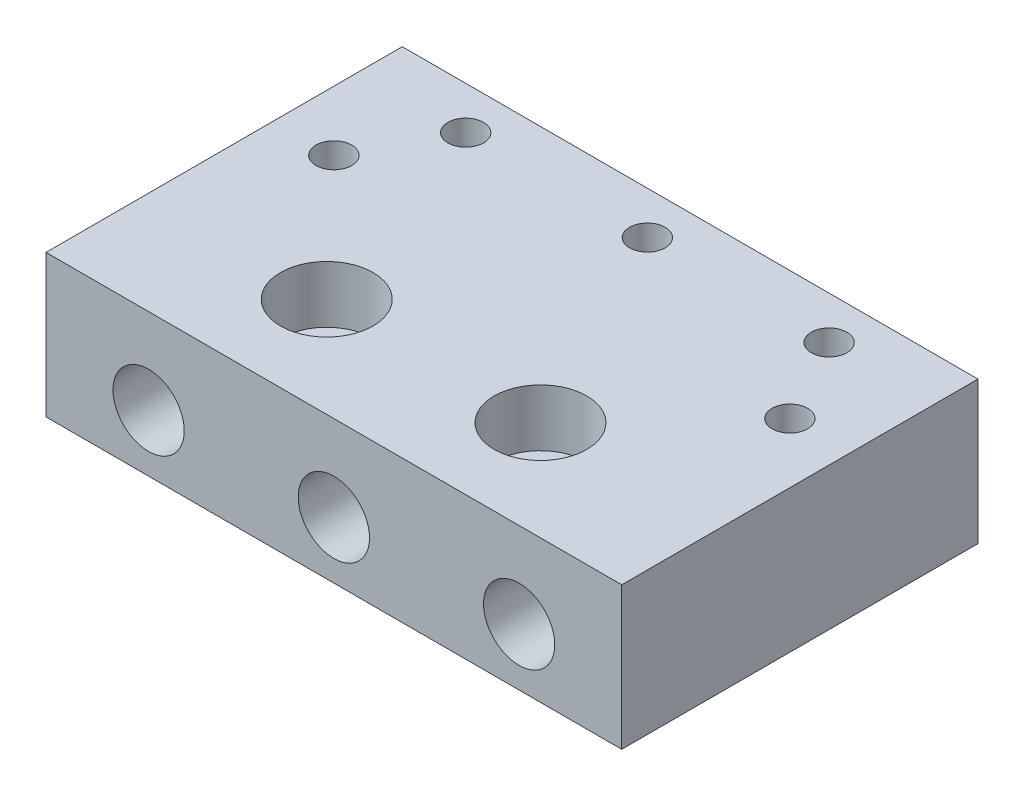
from build123d import *
from OCP.BRepFilletAPI import BRepFilletAPI_MakeChamfer

# Parameters (mm, degrees)
SKETCH1_W           = 40.4
SKETCH1_H           = 10
SKETCH1_R           = 2.5
BOSS_EXTRUDE1_DEPTH = 25
SKETCH2_R           = 1.55
CUT_EXTRUDE1_DEPTH  = 34.66065953
CUT_EXTRUDE2_REACH  = 35.661
SKETCH3_R           = 1.25
SKETCH4_R           = 1.25
CUT_EXTRUDE3_DEPTH  = 4
CHAMFER1_SIZE       = 0.891616335
CHAMFER1_SIZE_2     = 1.25
SKETCH5_R           = 3.25
CUT_EXTRUDE4_DEPTH  = 4


with BuildPart() as part:
    # Sketch1 → Boss-Extrude1 (new body)
    with BuildSketch(Plane.XY):
        with Locations((0, 1)):
            Rectangle(SKETCH1_W, SKETCH1_H)
        Circle(SKETCH1_R, mode=Mode.SUBTRACT)
        with Locations((13, 0)):
            Circle(SKETCH1_R, mode=Mode.SUBTRACT)
        with Locations((-13, 0)):
            Circle(SKETCH1_R, mode=Mode.SUBTRACT)
    extrude(amount=BOSS_EXTRUDE1_DEPTH)

    # Sketch2 → Cut-Extrude1 (cut, through all)
    with BuildSketch(Plane(origin=(0, 6, 0), x_dir=(1, 0, 0), z_dir=(0, 1, 0))):
        with Locations(Location((7.5, -18, 0), (0, 0, 180))):
            Circle(SKETCH2_R)
        with Locations(Location((-7.5, -18, 0), (0, 0, 180))):
            Circle(SKETCH2_R)
    extrude(amount=-CUT_EXTRUDE1_DEPTH, mode=Mode.SUBTRACT)

    # Sketch3 → Cut-Extrude2 (cut, up to next)
    with BuildSketch(Plane(origin=(0, 6, 0), x_dir=(1, 0, 0), z_dir=(0, 1, 0)), mode=Mode.PRIVATE) as cut_extrude2_sk1:
        with Locations(Location((0, -3, 0), (0, 0, 180))):
            Circle(SKETCH3_R)
    cut_extrude2_tool1 = extrude(cut_extrude2_sk1.sketch, amount=-CUT_EXTRUDE2_REACH, mode=Mode.PRIVATE) & part.part
    # Sketch3 → Cut-Extrude2 (cut, up to next)
    with BuildSketch(Plane(origin=(0, 6, 0), x_dir=(1, 0, 0), z_dir=(0, 1, 0)), mode=Mode.PRIVATE) as cut_extrude2_sk2:
        with Locations(Location((-12.75, -3, 0), (0, 0, 180))):
            Circle(SKETCH3_R)
    cut_extrude2_tool2 = extrude(cut_extrude2_sk2.sketch, amount=-CUT_EXTRUDE2_REACH, mode=Mode.PRIVATE) & part.part
    # Sketch3 → Cut-Extrude2 (cut, up to next)
    with BuildSketch(Plane(origin=(0, 6, 0), x_dir=(1, 0, 0), z_dir=(0, 1, 0)), mode=Mode.PRIVATE) as cut_extrude2_sk3:
        with Locations(Location((12.75, -3, 0), (0, 0, 180))):
            Circle(SKETCH3_R)
    cut_extrude2_tool3 = extrude(cut_extrude2_sk3.sketch, amount=-CUT_EXTRUDE2_REACH, mode=Mode.PRIVATE) & part.part
    add(cut_extrude2_tool1.solids().sort_by_distance((0, 6, 3))[0], mode=Mode.SUBTRACT)
    add(cut_extrude2_tool2.solids().sort_by_distance((-12.75, 6, 3))[0], mode=Mode.SUBTRACT)
    add(cut_extrude2_tool3.solids().sort_by_distance((12.75, 6, 3))[0], mode=Mode.SUBTRACT)

    # Sketch4 → Cut-Extrude3 (cut)
    with BuildSketch(Plane(origin=(0, 6, 0), x_dir=(1, 0, 0), z_dir=(0, 1, 0))):
        with Locations(Location((-16, -9, 0), (0, 0, 180))):
            Circle(SKETCH4_R)
        with Locations(Location((16, -9, 0), (0, 0, 180))):
            Circle(SKETCH4_R)
    extrude(amount=-CUT_EXTRUDE3_DEPTH, mode=Mode.SUBTRACT)

    # Chamfer1
    chamfer1_edges_1 = [part.edges().sort_by_distance(p)[0] for p in [
        (-14.75, 2, 9),
    ]]
    chamfer1_side_1 = [part.faces().sort_by_distance(p)[0] for p in [
        (-14.75, 2.017832327, 9),
    ]]
    chamfer1_edges_2 = [part.edges().sort_by_distance(p)[0] for p in [
        (17.25, 2, 9),
    ]]
    chamfer1_side_2 = [part.faces().sort_by_distance(p)[0] for p in [
        (17.25, 2.017832327, 9),
    ]]
    chamfer1 = BRepFilletAPI_MakeChamfer(part.part.solid().wrapped)
    for e in chamfer1_edges_1:
        chamfer1.Add(CHAMFER1_SIZE - 0.0001, CHAMFER1_SIZE_2 - 0.0001, e.wrapped, chamfer1_side_1[0].wrapped)
    for e in chamfer1_edges_2:
        chamfer1.Add(CHAMFER1_SIZE - 0.0001, CHAMFER1_SIZE_2 - 0.0001, e.wrapped, chamfer1_side_2[0].wrapped)
    add(Compound.cast(chamfer1.Shape()), mode=Mode.REPLACE)  # a hair under: the kernel refuses the full size

    # Sketch5 → Cut-Extrude4 (cut)
    with BuildSketch(Plane(origin=(0, 6, 0), x_dir=(1, 0, 0), z_dir=(0, 1, 0))):
        with Locations(Location((7.5, -18, 0), (0, 0, 180))):
            Circle(SKETCH5_R)
        with Locations(Location((-7.5, -18, 0), (0, 0, 180))):
            Circle(SKETCH5_R)
    extrude(amount=-CUT_EXTRUDE4_DEPTH, mode=Mode.SUBTRACT)


solid = part.part
